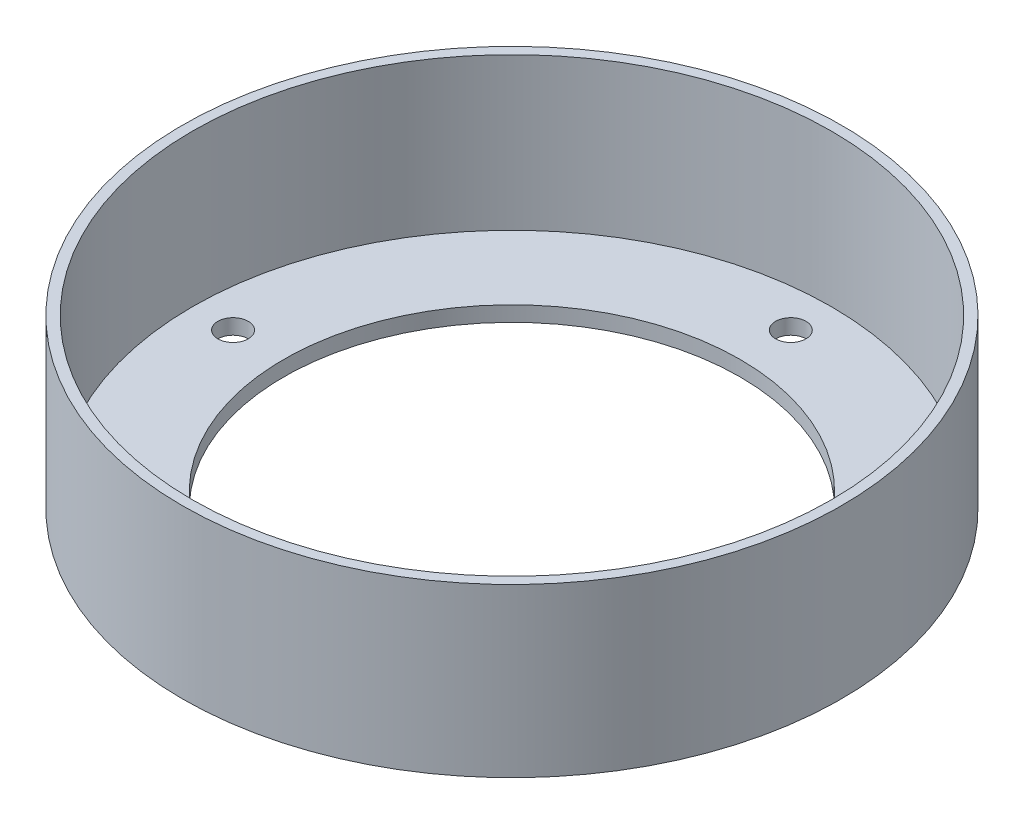
from build123d import *

# Parameters (mm, degrees)
SKETCH1_R           = 65
BOSS_EXTRUDE1_DEPTH = 3
SKETCH2_R           = 3
CUT_EXTRUDE1_DEPTH  = 92.972822073
CIRPATTERN1_COUNT   = 4
SKETCH3_R           = 65
SKETCH3_R_2         = 63
BOSS_EXTRUDE2_DEPTH = 30
SKETCH_1_R          = 45
CUT_EXTRUDE_1_DEPTH = 98.667804316


with BuildPart() as part:
    # Sketch1 → Boss-Extrude1 (new body)
    with BuildSketch(Plane(origin=(0, 0, 0), x_dir=(1, 0, 0), z_dir=(0, 1, 0))):
        Circle(SKETCH1_R)
    extrude(amount=BOSS_EXTRUDE1_DEPTH)

    # Sketch2 → Cut-Extrude1 (cut, through all)
    with BuildSketch(Plane(origin=(0, 3, 0), x_dir=(1, 0, 0), z_dir=(0, 1, 0))):
        with Locations((0, 55)):
            Circle(SKETCH2_R)
    cut_extrude1 = extrude(amount=-CUT_EXTRUDE1_DEPTH, mode=Mode.SUBTRACT)

    # CirPattern1: Cut-Extrude1 ×4 about axis
    cirpattern1_axis = Axis((0, 3, 0), (0, 1, 0))
    for i in range(1, CIRPATTERN1_COUNT):
        add(cut_extrude1.rotate(cirpattern1_axis, i * 360 / CIRPATTERN1_COUNT), mode=Mode.SUBTRACT)

    # Sketch3 → Boss-Extrude2 (add)
    with BuildSketch(Plane(origin=(0, 3, 0), x_dir=(1, 0, 0), z_dir=(0, 1, 0))):
        Circle(SKETCH3_R)
        Circle(SKETCH3_R_2, mode=Mode.SUBTRACT)
    extrude(amount=BOSS_EXTRUDE2_DEPTH)

    # 草圖1 → 除料-伸長1 (cut, through all)
    with BuildSketch(Plane.XZ):
        Circle(SKETCH_1_R)
    extrude(amount=-CUT_EXTRUDE_1_DEPTH, mode=Mode.SUBTRACT)


solid = part.part
